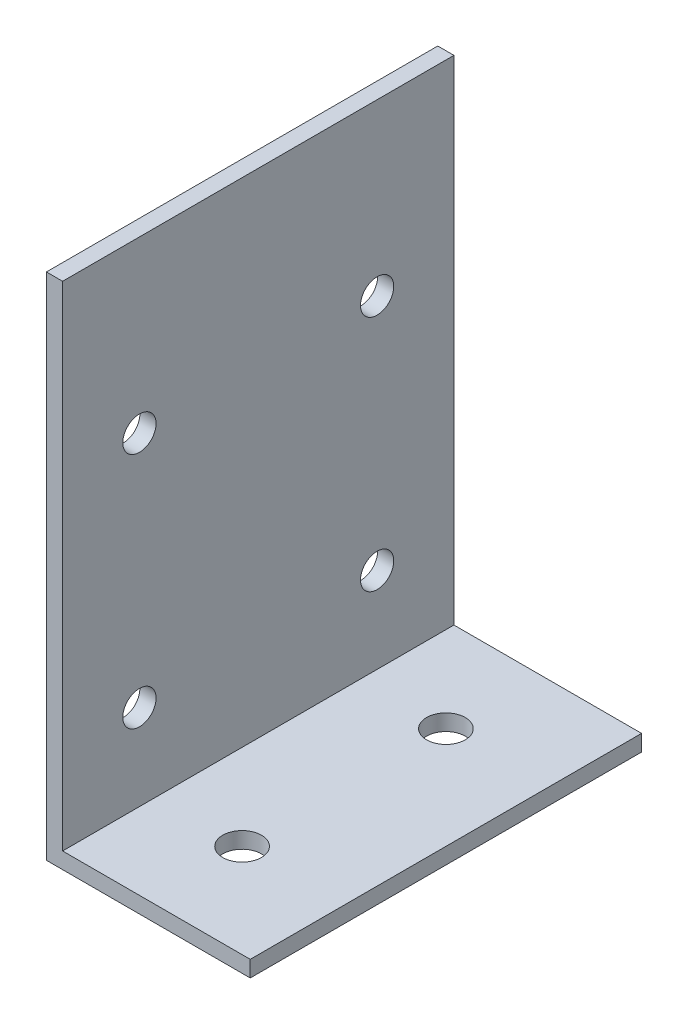
from build123d import *

# Parameters (mm, degrees)
BOSS_EXTRUDE1_DEPTH   = 19.2
F_4_CLEARANCE_HOLE1_D = 3.2639
F_6_CLEARANCE_HOLE1_D = 3.7973


with BuildPart() as part:
    # Sketch1 → Boss-Extrude1 (new body)
    with BuildSketch(Plane.XY):
        Polygon((0, 50), (0, 0), (20, 0), (20, 1.5875), (1.5875, 1.5875), (1.5875, 50), align=None)
    boss_extrude1 = extrude(amount=BOSS_EXTRUDE1_DEPTH)

    # #4 Clearance Hole1 (through all)
    with Locations(Plane.ZY):
        with Locations((11.6625, 33.325), (11.6625, 10)):
            f_4_clearance_hole1 = Hole(F_4_CLEARANCE_HOLE1_D / 2)

    # #6 Clearance Hole1 (through all)
    with Locations(Plane(origin=(10, 0, 10), x_dir=(0, 0, -1), z_dir=(0, -1, 0))):
        with Locations((0, 0)):
            f_6_clearance_hole1 = Hole(F_6_CLEARANCE_HOLE1_D / 2)

    # Mirror1: Boss-Extrude1, #4 Clearance Hole1, #6 Clearance Hole1 across plane
    add(boss_extrude1.mirror(Plane(origin=(0, 0, 0), x_dir=(1, 0, 0), z_dir=(0, 0, -1))))
    add(f_4_clearance_hole1.mirror(Plane(origin=(0, 0, 0), x_dir=(1, 0, 0), z_dir=(0, 0, -1))), mode=Mode.SUBTRACT)
    add(f_6_clearance_hole1.mirror(Plane(origin=(0, 0, 0), x_dir=(1, 0, 0), z_dir=(0, 0, -1))), mode=Mode.SUBTRACT)


solid = part.part
